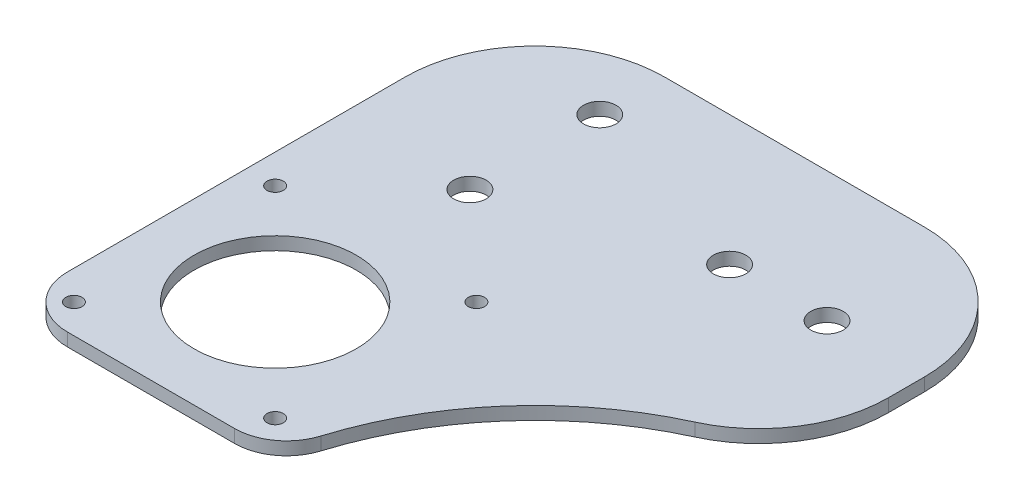
from build123d import *

# Parameters (mm, degrees)
SKETCH1_R           = 2.5
SKETCH1_W           = 40
SKETCH1_H           = 40
SKETCH1_R_2         = 1.25
SKETCH1_R_3         = 12.5
BOSS_EXTRUDE1_DEPTH = 2
FILLET1_R           = 50
FILLET2_R           = 20
FILLET3_R           = 8


with BuildPart() as part:
    # Sketch1 → Boss-Extrude1 (new body)
    # profile 1 of 2: a face of its own
    with BuildSketch(Plane(origin=(0, 0, 0), x_dir=(1, 0, 0), z_dir=(0, 1, 0))):
        Polygon((80, 0), (80, 40), (0, 40), (0, 0), (40, 0), align=None)
        with Locations(Location((20, 10, 0), (0, 0, 270))):
            Circle(SKETCH1_R, mode=Mode.SUBTRACT)
        with Locations(Location((20, 30, 0), (0, 0, 270))):
            Circle(SKETCH1_R, mode=Mode.SUBTRACT)
        with Locations(Location((50, 20, 0), (0, 0, 270))):
            Circle(SKETCH1_R, mode=Mode.SUBTRACT)
        with Locations(Location((65, 20, 0), (0, 0, 270))):
            Circle(SKETCH1_R, mode=Mode.SUBTRACT)
    # profile 2 of 2: a face of its own
    with BuildSketch(Plane(origin=(0, 0, 0), x_dir=(1, 0, 0), z_dir=(0, 1, 0))):
        with Locations((20, -20)):
            Rectangle(SKETCH1_W, SKETCH1_H)
        with Locations(Location((4.5, -35.5, 0), (0, 0, 270))):
            Circle(SKETCH1_R_2, mode=Mode.SUBTRACT)
        with Locations(Location((35.5, -35.5, 0), (0, 0, 270))):
            Circle(SKETCH1_R_2, mode=Mode.SUBTRACT)
        with Locations(Location((20, -20, 0), (0, 0, 270))):
            Circle(SKETCH1_R_3, mode=Mode.SUBTRACT)
        with Locations(Location((4.5, -4.5, 0), (0, 0, 270))):
            Circle(SKETCH1_R_2, mode=Mode.SUBTRACT)
        with Locations(Location((35.5, -4.5, 0), (0, 0, 270))):
            Circle(SKETCH1_R_2, mode=Mode.SUBTRACT)
    extrude(amount=BOSS_EXTRUDE1_DEPTH)

    # Fillet1
    # the kernel refuses this fillet: 50 mm, written as the material it adds along each edge
    with BuildSketch(Plane(origin=(40, 0, 0), x_dir=(0, 0, 1), z_dir=(0, 1, 0))) as fillet1_piece_1:
        with BuildLine():
            CenterArc((49.154759474, 49.154759474), FILLET1_R, 190.550098012, 68.899803976)
            Line((0, 40), (0, 0))
            Line((0, 0), (40, 0))
        make_face()
    extrude(amount=2)

    # Fillet2
    fillet2_edges = [part.edges().sort_by_distance(p)[0] for p in [
        (80, 1, -40),
        (80, 1, 0),
        (0, 1, -40),
    ]]
    fillet(fillet2_edges, radius=FILLET2_R)

    # Fillet3
    fillet3_edges = [part.edges().sort_by_distance(p)[0] for p in [
        (40, 1, 40),
        (0, 1, 40),
    ]]
    fillet(fillet3_edges, radius=FILLET3_R)


solid = part.part
